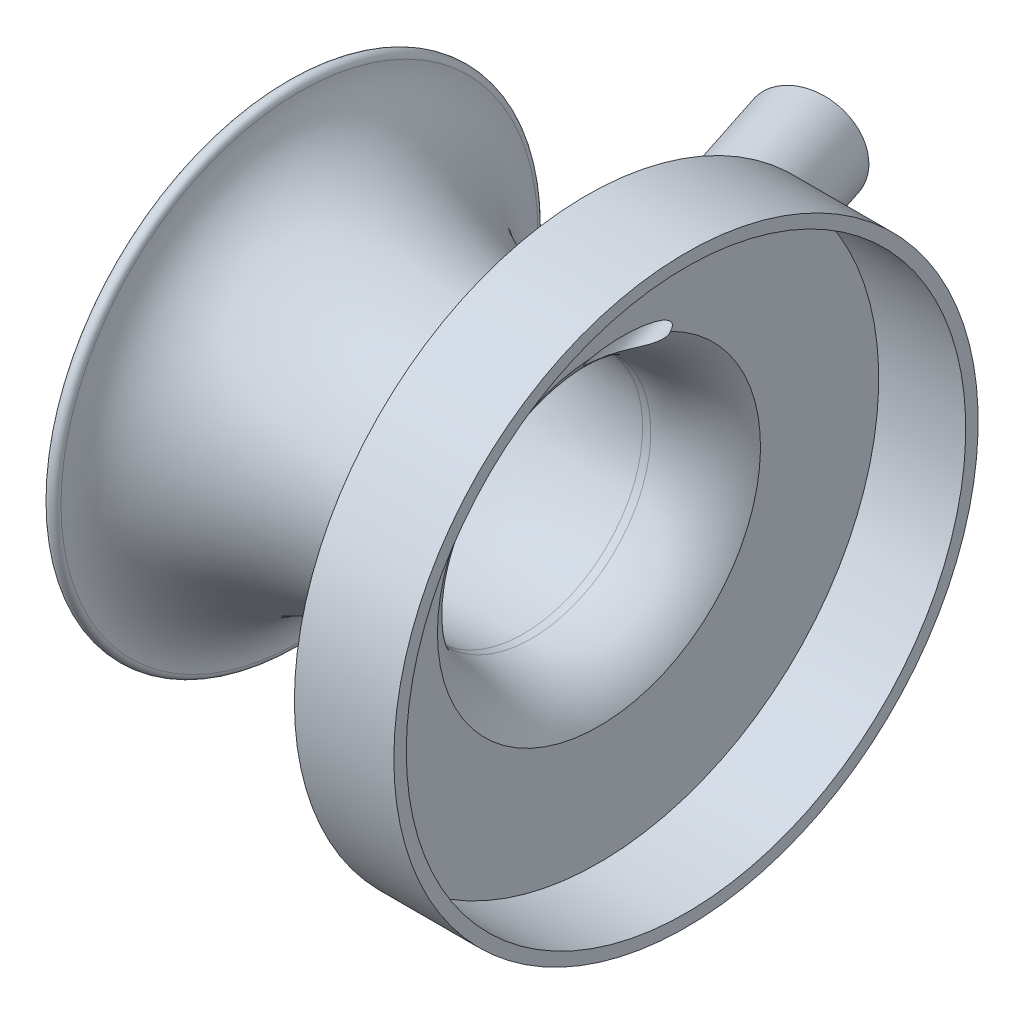
from build123d import *

# Parameters (mm, degrees)
BOSS_EXTRUDE1_REACH      = 137.692
SKETCH2_R                = 5.55625
SKETCH2_R_2              = 3.175
CUT_EXTRUDE1_DEPTH       = 136.691531925
CUT_EXTRUDE1_DEPTH_BACK  = 40.64
SKETCH2_3_R              = 3.175
BOSS_EXTRUDE3_DEPTH      = 25.4
BOSS_EXTRUDE3_DEPTH_BACK = 1.016
SKETCH2_4_R              = 10.16
SKETCH2_4_R_2            = 5.55625


with BuildPart() as part:
    # Sketch1 → Revolve1 (revolve)
    with BuildSketch(Plane.XY):
        with BuildLine():
            Line((-17.78, 33.403326565), (-17.78, 57.553265565))
            Line((-17.78, 57.553265565), (0, 57.553265565))
            Line((0, 57.553265565), (0, 60.093265565))
            Line((0, 60.093265565), (-20.32, 60.093265565))
            Line((-20.32, 60.093265565), (-20.32, 34.099917601))
            ThreePointArc((-20.32, 34.099917601), (-25.180755406, 29.340296974), (-31.679989745, 27.330101799))
            Line((-31.679989745, 27.330101799), (-33.2365138, 27.301858752))
            add(Edge.make_bspline(
                [(-78.987624158, 49.101480512), (-78.987360194, 48.465111349), (-78.864304013, 47.206846617), (-78.115388687, 44.647319746), (-76.172826927, 41.382782544), (-72.124745626, 37.542839726), (-66.466655311, 34.059492548), (-59.433052835, 31.146010824), (-51.317519817, 28.959245462), (-42.474533701, 27.605945243), (-36.295988449, 27.30132344), (-33.2365138, 27.301858752)],
                knots=[3.141592654, 3.141592654, 3.141592654, 3.141592654, 3.239737699, 3.337882745, 3.534172837, 3.730462929, 3.92675302, 4.123043112, 4.319333204, 4.515623295, 4.711913387, 4.711913387, 4.711913387, 4.711913387], degree=3))
            ThreePointArc((-78.987624158, 49.101480512), (-80.258150841, 50.37095361), (-81.52762394, 49.100426927))
            add(Edge.make_bspline(
                [(-81.52762394, 49.100426927), (-81.51752006, 24.741829023), (-33.213096121, 24.761865565)],
                knots=[0, 0, 0, 1.570796327, 1.570796327, 1.570796327], degree=2, weights=[1, 0.707106781, 1]))
            Line((-33.213096121, 24.761865565), (-31.579850242, 24.791500725))
            ThreePointArc((-31.579850242, 24.791500725), (-23.583053734, 27.339753754), (-17.78, 33.403326565))
        make_face()
    revolve(axis=Axis((-34.322208184, 0.403265565, 0), (1, 0, 0)))


with BuildPart() as body_2:

    # Sketch2 → Boss-Extrude1 (new, up to next)
    with BuildSketch(Plane(origin=(-13.343353817, 0, -41.066620374), x_dir=(0, -1, 0), z_dir=(-0.3090169943749514, 0, -0.9510565162951523)), mode=Mode.PRIVATE) as boss_extrude1_sk1:
        with Locations((-30.889259617, 15.45046582)):
            Circle(SKETCH2_R)
        with Locations((-30.889259617, 15.45046582)):
            Circle(SKETCH2_R_2, mode=Mode.SUBTRACT)
    boss_extrude1_tool1 = extrude(boss_extrude1_sk1.sketch, amount=-BOSS_EXTRUDE1_REACH, mode=Mode.PRIVATE) - part.part
    add(boss_extrude1_tool1.solids().sort_by_distance((-28.03762, 36.288355, -36.292164))[0])


with BuildPart() as part_1:
    add(part.part)

    # Sketch2<3> → Cut-Extrude1 (cut, two sides: drawn at the far end of the back side and taken through both)
    with BuildSketch(Plane(origin=(-13.343353817, 0, -41.066620374), x_dir=(0, -1, 0), z_dir=(-0.3090169943749514, 0, -0.9510565162951523)).offset(-CUT_EXTRUDE1_DEPTH_BACK)):
        with Locations((-30.889259617, 15.45046582)):
            Circle(SKETCH2_3_R)
    extrude(amount=CUT_EXTRUDE1_DEPTH + CUT_EXTRUDE1_DEPTH_BACK, mode=Mode.SUBTRACT)

    add(body_2.part)  # Boss-Extrude3 merges body 2
    # Sketch2<4> → Boss-Extrude3 (add, two sides: drawn at the far end of the back side and taken through both)
    with BuildSketch(Plane(origin=(-13.343353817, 0, -41.066620374), x_dir=(0, -1, 0), z_dir=(-0.3090169943749514, 0, -0.9510565162951523)).offset(-BOSS_EXTRUDE3_DEPTH_BACK)):
        with Locations((-30.889259617, 15.45046582)):
            Circle(SKETCH2_4_R)
        with Locations((-30.889259617, 15.45046582)):
            Circle(SKETCH2_4_R_2, mode=Mode.SUBTRACT)
    extrude(amount=BOSS_EXTRUDE3_DEPTH + BOSS_EXTRUDE3_DEPTH_BACK)


solid = part_1.part
